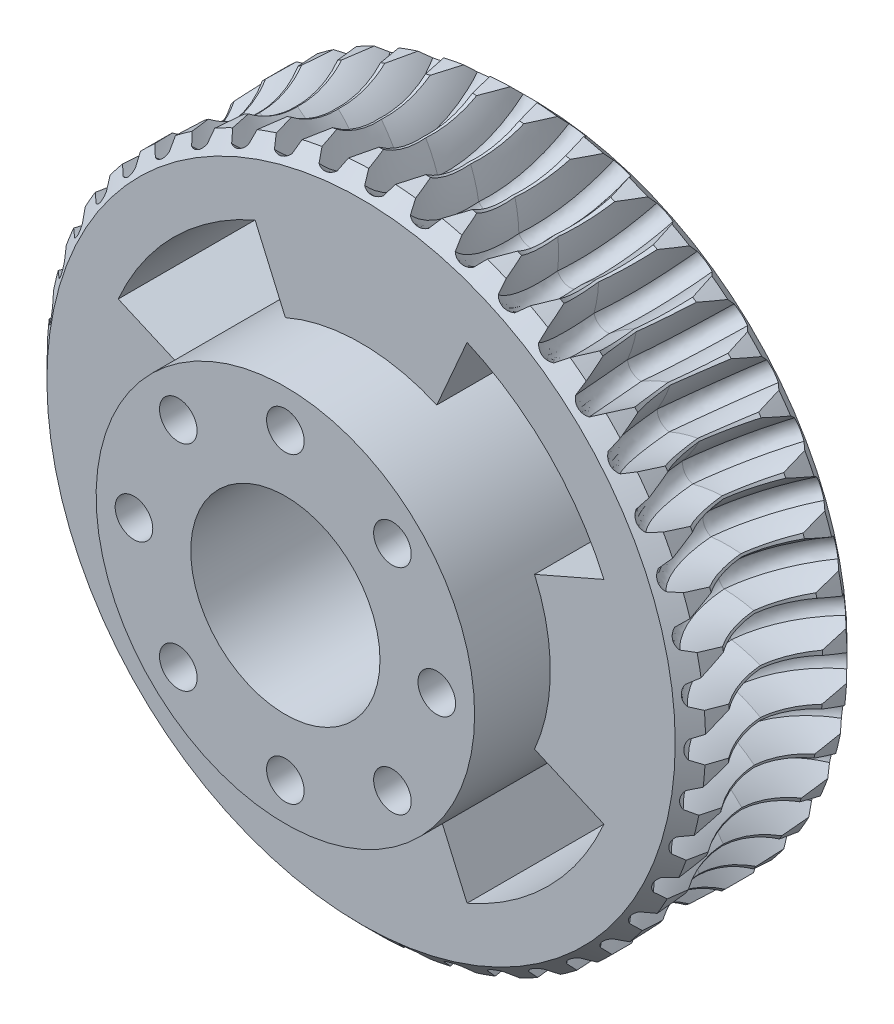
from build123d import *
from build123d.topology import SkipClean

# Parameters (mm, degrees)
SKETCH1_R              = 43.5
SKETCH1_R_2            = 12.5
BOSS_EXTRUDE1_DEPTH    = 11.35
CHAMFER1_SIZE          = 2
SKETCH2_R              = 10.5
CUT_SWEEP1_PITCH       = 6
CUT_SWEEP1_HEIGHT      = 1.5
CUT_SWEEP1_RADIUS      = 10.5
CUT_SWEEP1_START_ANGLE = -90
CUT_SWEEP2_PITCH       = 6
CUT_SWEEP2_HEIGHT      = 1.5
CUT_SWEEP2_RADIUS      = 10.5
CUT_SWEEP2_START_ANGLE = -90
CIRPATTERN1_COUNT      = 44
SKETCH7_R              = 25
SKETCH7_R_2            = 12.5
BOSS_EXTRUDE2_DEPTH    = 10
SKETCH8_R              = 2.485256832
CUT_EXTRUDE1_DEPTH     = 6
CUT_EXTRUDE2_DEPTH     = 66.558026145


with BuildPart() as part:
    # Sketch1 → Boss-Extrude1 (new, symmetric)
    with BuildSketch(Plane.XY):
        Circle(SKETCH1_R)
        Circle(SKETCH1_R_2, mode=Mode.SUBTRACT)
    extrude(amount=BOSS_EXTRUDE1_DEPTH, both=True)

    # Chamfer1
    chamfer1_edges = [part.edges().sort_by_distance(p)[0] for p in [
        (-43.5, 0, -11.35),
        (-43.5, 0, 11.35),
    ]]
    chamfer(chamfer1_edges, length=CHAMFER1_SIZE)

    # Sketch2 → Cut-Revolve1 (revolve, cut)
    with BuildSketch(Plane(origin=(0, 0, 0), x_dir=(0, 0, -1), z_dir=(1, 0, 0)), mode=Mode.PRIVATE) as cut_revolve1_sk:
        with Locations((0, -52)):
            Circle(SKETCH2_R)
    revolve(cut_revolve1_sk.sketch.rotate(Axis((0, 0, 0), (0, 0, 1)), 270), axis=Axis((0, 0, 0), (0, 0, 1)), mode=Mode.SUBTRACT)

    # Cut-Sweep1: sweep along a helix
    with BuildLine() as cut_sweep1_path:
        add(Helix(CUT_SWEEP1_PITCH, CUT_SWEEP1_HEIGHT, CUT_SWEEP1_RADIUS, center=(0, -52, 0), direction=(-1, 0, 0), mode=Mode.PRIVATE).rotate(Axis((0, -52, 0), (-1, 0, 0)), CUT_SWEEP1_START_ANGLE))
    # Sketch4 → Cut-Sweep1 (sweep, cut)
    with BuildSketch(Plane.XY):
        with BuildLine():
            Line((-3.45, -42.44), (-3.45, -46.04))
            Line((-3.45, -46.04), (3.45, -46.04))
            Line((3.45, -46.04), (3.45, -42.44))
            ThreePointArc((3.45, -42.44), (2.158263743, -40.196055995), (1.201831935, -37.79))
            ThreePointArc((1.201831935, -37.79), (0, -37.33), (-1.201831935, -37.79))
            ThreePointArc((-1.201831935, -37.79), (-2.158263743, -40.196055995), (-3.45, -42.44))
        make_face()
    cut_sweep1 = sweep(path=cut_sweep1_path.line, is_frenet=True, mode=Mode.SUBTRACT)

    # Cut-Sweep2: sweep along a helix
    with BuildLine() as cut_sweep2_path:
        add(Helix(CUT_SWEEP2_PITCH, CUT_SWEEP2_HEIGHT, CUT_SWEEP2_RADIUS, center=(0, -52, 0), direction=(-1, 0, 0), lefthand=True, mode=Mode.PRIVATE).rotate(Axis((0, -52, 0), (-1, 0, 0)), CUT_SWEEP2_START_ANGLE))
    # Sketch6 → Cut-Sweep2 (sweep, cut)
    with BuildSketch(Plane.XY):
        with BuildLine():
            Line((-3.45, -42.44), (-3.45, -46.04))
            Line((-3.45, -46.04), (3.45, -46.04))
            Line((3.45, -46.04), (3.45, -42.44))
            ThreePointArc((3.45, -42.44), (2.158263743, -40.196055995), (1.201831935, -37.79))
            ThreePointArc((1.201831935, -37.79), (0, -37.33), (-1.201831935, -37.79))
            ThreePointArc((-1.201831935, -37.79), (-2.158263743, -40.196055995), (-3.45, -42.44))
        make_face()
    cut_sweep2 = sweep(path=cut_sweep2_path.line, is_frenet=True, mode=Mode.SUBTRACT)

    # CirPattern1: Cut-Sweep1, Cut-Sweep2 ×44 about axis
    cirpattern1_axis = Axis((0, 0, -11.35), (0, 0, 1))
    add([cut_sweep1.rotate(cirpattern1_axis, i * 360 / CIRPATTERN1_COUNT) for i in range(1, CIRPATTERN1_COUNT)], mode=Mode.SUBTRACT)
    add([cut_sweep2.rotate(cirpattern1_axis, i * 360 / CIRPATTERN1_COUNT) for i in range(1, CIRPATTERN1_COUNT)], mode=Mode.SUBTRACT)

    # Sketch7 → Boss-Extrude2 (add)
    with BuildSketch(Plane.XY.offset(11.35)):
        Circle(SKETCH7_R)
        Circle(SKETCH7_R_2, mode=Mode.SUBTRACT)
    extrude(amount=BOSS_EXTRUDE2_DEPTH)

    # Sketch8 → Cut-Extrude1 (cut)
    with BuildSketch(Plane.XY.offset(21.35)):
        with Locations((0, 20)):
            Circle(SKETCH8_R)
        with Locations((14.142135624, 14.142135624)):
            Circle(SKETCH8_R)
        with Locations((20, 0)):
            Circle(SKETCH8_R)
        with Locations((14.142135624, -14.142135624)):
            Circle(SKETCH8_R)
        with Locations((0, -20)):
            Circle(SKETCH8_R)
        with Locations((-14.142135624, -14.142135624)):
            Circle(SKETCH8_R)
        with Locations((-20, 0)):
            Circle(SKETCH8_R)
        with Locations((-14.142135624, 14.142135624)):
            Circle(SKETCH8_R)
    extrude(amount=-CUT_EXTRUDE1_DEPTH, mode=Mode.SUBTRACT)

    # Sketch11 → Cut-Extrude2 (cut, through all)
    with SkipClean():  # the faces are left unmerged after this step: merging them gives an invalid solid
        with BuildSketch(Plane.XY.offset(11.35)):
            with BuildLine():
                Line((-10, 22.912878475), (-14, 32.078029865))
                ThreePointArc((-14, 32.078029865), (-24.748737342, 24.748737342), (-32.078029865, 14))
                Line((-32.078029865, 14), (-22.912878475, 10))
                ThreePointArc((-22.912878475, 10), (-17.67766953, 17.67766953), (-10, 22.912878475))
            make_face()
            with BuildLine():
                Line((10, 22.912878475), (14, 32.078029865))
                ThreePointArc((14, 32.078029865), (24.748737342, 24.748737342), (32.078029865, 14))
                Line((32.078029865, 14), (22.912878475, 10))
                ThreePointArc((22.912878475, 10), (17.67766953, 17.67766953), (10, 22.912878475))
            make_face()
            with BuildLine():
                Line((-22.912878475, -10), (-32.078029865, -14))
                ThreePointArc((-32.078029865, -14), (-24.748737342, -24.748737342), (-14, -32.078029865))
                Line((-14, -32.078029865), (-10, -22.912878475))
                ThreePointArc((-10, -22.912878475), (-17.67766953, -17.67766953), (-22.912878475, -10))
            make_face()
            with BuildLine():
                Line((10, -22.912878475), (14, -32.078029865))
                ThreePointArc((14, -32.078029865), (24.748737342, -24.748737342), (32.078029865, -14))
                Line((32.078029865, -14), (22.912878475, -10))
                ThreePointArc((22.912878475, -10), (17.67766953, -17.67766953), (10, -22.912878475))
            make_face()
        extrude(amount=-CUT_EXTRUDE2_DEPTH, mode=Mode.SUBTRACT)


solid = part.part
